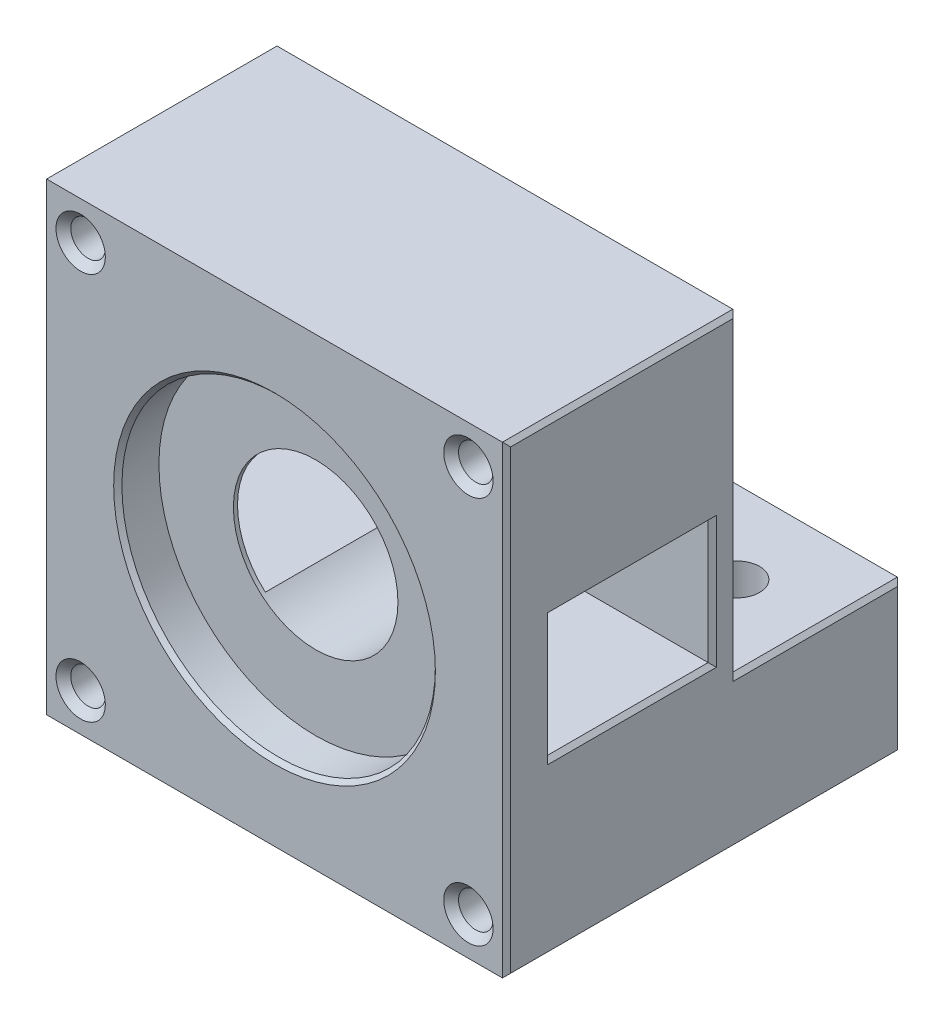
from build123d import *

# Parameters (mm, degrees)
SKETCH1_W                       = 56.4
SKETCH1_H                       = 56.4
BOSS_EXTRUDE1_DEPTH             = 28
SKETCH2_W                       = 56.4
SKETCH2_H                       = 18.2
BOSS_EXTRUDE2_DEPTH             = 20
CBORE_FOR_M5_SHCS1_D            = 5.5
CBORE_FOR_M5_SHCS1_CBORE_D      = 10
CBORE_FOR_M5_SHCS1_CBORE_DEPTH  = 13
SKETCH9_R                       = 19.05
CUT_EXTRUDE1_DEPTH              = 5
CHAMFER1_SIZE                   = 0.5
SKETCH10_R                      = 10
CUT_EXTRUDE2_DEPTH              = 59.647080064
SKETCH11_W                      = 19.5
SKETCH11_H                      = 15
CUT_EXTRUDE3_DEPTH              = 69.994202655
M5X0_8_TAPPED_HOLE1_D           = 4.2
M5X0_8_TAPPED_HOLE1_CSINK_D     = 6
M5X0_8_TAPPED_HOLE1_CSINK_ANGLE = 90
CHAMFER2_SIZE                   = 0.5


with BuildPart() as part:
    # Sketch1 → Boss-Extrude1 (new body)
    with BuildSketch(Plane.XY):
        Rectangle(SKETCH1_W, SKETCH1_H)
    extrude(amount=BOSS_EXTRUDE1_DEPTH)

    # Sketch2 → Boss-Extrude2 (add)
    with BuildSketch(Plane(origin=(0, 0, 0), x_dir=(-1, 0, 0), z_dir=(0, 0, -1))):
        with Locations((0, -19.1)):
            Rectangle(SKETCH2_W, SKETCH2_H)
    extrude(amount=BOSS_EXTRUDE2_DEPTH)

    # CBORE for M5 SHCS1 (through all)
    with Locations(Plane(origin=(0, -28.2, 0), x_dir=(-1, 0, 0), z_dir=(0, -1, 0))):
        with Locations((18.2, 10), (0, 10), (-18.2, 10)):
            CounterBoreHole(CBORE_FOR_M5_SHCS1_D / 2, CBORE_FOR_M5_SHCS1_CBORE_D / 2, CBORE_FOR_M5_SHCS1_CBORE_DEPTH)

    # Sketch9 → Cut-Extrude1 (cut)
    with BuildSketch(Plane.XY.offset(28)):
        Circle(SKETCH9_R)
    extrude(amount=-CUT_EXTRUDE1_DEPTH, mode=Mode.SUBTRACT)

    # Chamfer1
    chamfer1_edges = [part.edges().sort_by_distance(p)[0] for p in [
        (-19.05, 0, 28),
    ]]
    chamfer(chamfer1_edges, length=CHAMFER1_SIZE)

    # Sketch10 → Cut-Extrude2 (cut, through all)
    with BuildSketch(Plane.XY.offset(23)):
        Circle(SKETCH10_R)
    extrude(amount=-CUT_EXTRUDE2_DEPTH, mode=Mode.SUBTRACT)

    # Sketch11 → Cut-Extrude3 (cut, through all)
    with BuildSketch(Plane.ZY.offset(28.2)):
        with Locations((12.75, 0)):
            Rectangle(SKETCH11_W, SKETCH11_H)
    extrude(amount=-CUT_EXTRUDE3_DEPTH, mode=Mode.SUBTRACT)

    # M5x0.8 Tapped Hole1 (through all)
    with Locations(Plane.XY.offset(28)):
        with Locations((23.565, 23.565), (23.565, -23.565), (-23.565, -23.565), (-23.565, 23.565)):
            CounterSinkHole(M5X0_8_TAPPED_HOLE1_D / 2, M5X0_8_TAPPED_HOLE1_CSINK_D / 2, counter_sink_angle=M5X0_8_TAPPED_HOLE1_CSINK_ANGLE)

    # Chamfer2
    chamfer2_edges = [part.edges().sort_by_distance(p)[0] for p in [
        (28.2, 0, 28),
        (28.2, 28.2, 14),
        (28.2, 9.1, 0),
        (28.2, -10, -10),
        (28.2, -19.1, -20),
        (28.2, -28.2, 4),
        (28.2, 0, 3),
        (28.2, 7.5, 12.75),
        (28.2, 0, 22.5),
        (28.2, -7.5, 12.75),
        (-28.2, 28.2, 14),
        (-28.2, 0, 28),
        (-28.2, -28.2, 4),
        (-28.2, -19.1, -20),
        (-28.2, -10, -10),
        (-28.2, 9.1, 0),
        (-28.2, 0, 3),
        (-28.2, -7.5, 12.75),
        (-28.2, 0, 22.5),
        (-28.2, 7.5, 12.75),
    ]]
    chamfer(chamfer2_edges, length=CHAMFER2_SIZE)


solid = part.part
